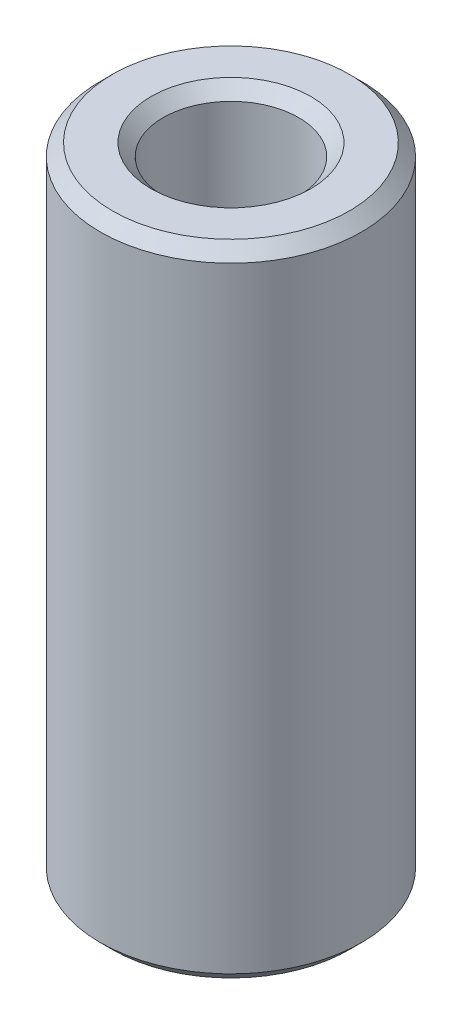
from build123d import *

# Parameters (mm, degrees)
SKETCH1_R           = 30
BOSS_EXTRUDE1_DEPTH = 146.986770155
SKETCH2_R           = 15.568670537
CUT_EXTRUDE1_DEPTH  = 153.987289017
CHAMFER1_SIZE       = 2.79521146


with BuildPart() as part:
    # Sketch1 → Boss-Extrude1 (new body)
    with BuildSketch(Plane(origin=(0, 0, 0), x_dir=(1, 0, 0), z_dir=(0, 1, 0))):
        Circle(SKETCH1_R)
    extrude(amount=BOSS_EXTRUDE1_DEPTH)

    # Sketch2 → Cut-Extrude1 (cut, through all)
    with BuildSketch(Plane(origin=(0, 0, 0), x_dir=(1, 0, 0), z_dir=(0, 1, 0))):
        Circle(SKETCH2_R)
    extrude(amount=CUT_EXTRUDE1_DEPTH, mode=Mode.SUBTRACT)

    # Chamfer1
    chamfer1_edges = [part.edges().sort_by_distance(p)[0] for p in [
        (-15.568670537, 146.986770155, 0),
        (-15.568670537, 0, 0),
        (-30, 0, 0),
        (-30, 146.986770155, 0),
    ]]
    chamfer(chamfer1_edges, length=CHAMFER1_SIZE)


solid = part.part
